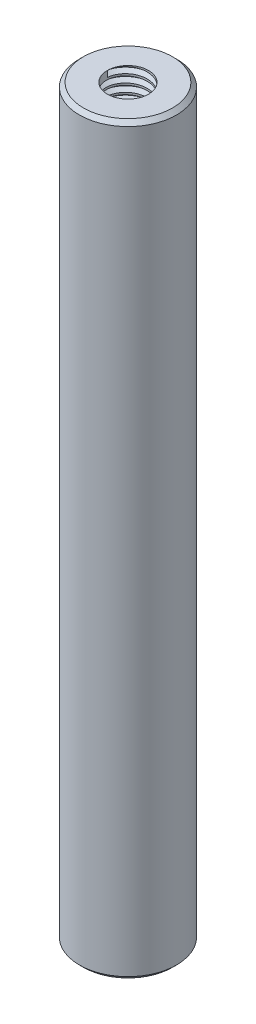
from build123d import *
from build123d.topology import SkipClean

# Parameters (mm, degrees)
CROQUIS2_R              = 4.7625
SALIENTE_EXTRUIR1_DEPTH = 36.5125
CHAFL_N1_SIZE           = 0.396875
TAP_START               = 36.5125
CROQUIS3_R              = 2.0193
TAP_HOLE_1_DEPTH        = 19.05
TAP_START_2             = -17.4625
CROQUIS3_2_R            = 2.0193
TAP_HOLE_2_DEPTH        = 19.05
ROSCA1_PITCH            = 0.79375
ROSCA2_PITCH            = 0.79375


with BuildPart() as part:
    # Croquis2 → Saliente-Extruir1 (new, symmetric)
    with BuildSketch(Plane(origin=(0, 0, 0), x_dir=(1, 0, 0), z_dir=(0, 1, 0))):
        with Locations(Location((0, 0, 0), (0, 0, 270))):
            Circle(CROQUIS2_R)
    extrude(amount=SALIENTE_EXTRUIR1_DEPTH, both=True)

    # Chaflán1
    chafl_n1_edges = [part.edges().sort_by_distance(p)[0] for p in [
        (0, -36.5125, -4.7625),
        (0, 36.5125, -4.7625),
    ]]
    chamfer(chafl_n1_edges, length=CHAFL_N1_SIZE)

    # Croquis3 → Tap Hole 1 (cut)
    with BuildSketch(Plane(origin=(0, 0, 0), x_dir=(1, 0, 0), z_dir=(0, 1, 0)).offset(TAP_START)):
        with Locations(Location((0, 0, 0), (0, 0, 270))):
            Circle(CROQUIS3_R)
    extrude(amount=-TAP_HOLE_1_DEPTH, mode=Mode.SUBTRACT)

    # Croquis3<2> → Tap Hole 2 (cut)
    with BuildSketch(Plane(origin=(0, 0, 0), x_dir=(1, 0, 0), z_dir=(0, 1, 0)).offset(TAP_START_2)):
        with Locations(Location((0, 0, 0), (0, 0, 270))):
            Circle(CROQUIS3_2_R)
    extrude(amount=-TAP_HOLE_2_DEPTH, mode=Mode.SUBTRACT)

    # Rosca1: arcs per turn and ends read off the stored shape
    # Rosca1: the profile of Perfil de rosca1 profile screwed along a right-hand helix through 24 turns, 8 arcs to a turn; built about Z, then put on its axis
    rosca1_z = Axis((0, 0, 0), (0, 0, 1))
    rosca1_corners = [(2.019, 0, -0.000173205), (2.448929788, 0, 0.248046874), (2.448929788, 0, 0.347265624), (2.019, 0, 0.595485703)]
    with BuildLine(mode=Mode.PRIVATE) as rosca1_profile:
        Line(rosca1_corners[0], rosca1_corners[1])
        Line(rosca1_corners[1], rosca1_corners[2])
        Line(rosca1_corners[2], rosca1_corners[3])
        Line(rosca1_corners[3], rosca1_corners[0])
    rosca1_cap = Face(rosca1_profile.wire())
    rosca1_turn_angles = [0, 22.5, 45, 67.5, 90, 112.5, 135, 157.5, 180, 202.5, 225, 247.5, 270, 292.5, 315, 337.5, 360]
    rosca1_turn_weights = [1, 0.9238795325112867, 1, 0.9238795325112867, 1, 0.9238795325112867, 1, 0.9238795325112867, 1, 0.9238795325112867, 1, 0.9238795325112867, 1, 0.9238795325112867, 1, 0.9238795325112867, 1]
    rosca1_turn_rails = [Edge.make_bspline([Vector(p[0], p[1], 0).rotate(rosca1_z, rosca1_turn_angles[k]) / rosca1_turn_weights[k] + Vector(0, 0, p[2] + ROSCA1_PITCH * rosca1_turn_angles[k] / 360) for k in range(17)], [0, 0, 0, 1, 1, 2, 2, 3, 3, 4, 4, 5, 5, 6, 6, 7, 7, 8, 8, 8], 2, rosca1_turn_weights) for p in rosca1_corners]
    rosca1_turn_sides = [Face.make_surface_from_curves(rosca1_turn_rails[p[0]], rosca1_turn_rails[p[1]]) for p in [(0, 1), (1, 2), (2, 3), (3, 0)]]
    rosca1 = Plane(origin=(0, -36.5125, 0), x_dir=(1, 0, 0), z_dir=(0, 1, 0)) * Solid(Shell([*[p.moved(Location((0, 0, ROSCA1_PITCH * i))) for i in range(24) for p in rosca1_turn_sides], rosca1_cap, rosca1_cap.rotate(rosca1_z, 8640).moved(Location((0, 0, ROSCA1_PITCH * 8640 / 360)))]))
    add(rosca1, mode=Mode.SUBTRACT)

    # Rosca2: arcs per turn and ends read off the stored shape
    # Rosca2: the profile of Perfil de rosca2 profile screwed along a right-hand helix through 24 turns, 8 arcs to a turn; built about Z, then put on its axis
    with SkipClean():  # the faces are left unmerged after this step: merging them gives an invalid solid
        rosca2_z = Axis((0, 0, 0), (0, 0, 1))
        rosca2_corners = [(2.019, 0, -0.000173205), (2.448929788, 0, 0.248046874), (2.448929788, 0, 0.347265624), (2.019, 0, 0.595485703)]
        with BuildLine(mode=Mode.PRIVATE) as rosca2_profile:
            Line(rosca2_corners[0], rosca2_corners[1])
            Line(rosca2_corners[1], rosca2_corners[2])
            Line(rosca2_corners[2], rosca2_corners[3])
            Line(rosca2_corners[3], rosca2_corners[0])
        rosca2_cap = Face(rosca2_profile.wire())
        rosca2_turn_angles = [0, 22.5, 45, 67.5, 90, 112.5, 135, 157.5, 180, 202.5, 225, 247.5, 270, 292.5, 315, 337.5, 360]
        rosca2_turn_weights = [1, 0.9238795325112867, 1, 0.9238795325112867, 1, 0.9238795325112867, 1, 0.9238795325112867, 1, 0.9238795325112867, 1, 0.9238795325112867, 1, 0.9238795325112867, 1, 0.9238795325112867, 1]
        rosca2_turn_rails = [Edge.make_bspline([Vector(p[0], p[1], 0).rotate(rosca2_z, rosca2_turn_angles[k]) / rosca2_turn_weights[k] + Vector(0, 0, p[2] + ROSCA2_PITCH * rosca2_turn_angles[k] / 360) for k in range(17)], [0, 0, 0, 1, 1, 2, 2, 3, 3, 4, 4, 5, 5, 6, 6, 7, 7, 8, 8, 8], 2, rosca2_turn_weights) for p in rosca2_corners]
        rosca2_turn_sides = [Face.make_surface_from_curves(rosca2_turn_rails[p[0]], rosca2_turn_rails[p[1]]) for p in [(0, 1), (1, 2), (2, 3), (3, 0)]]
        rosca2 = Plane(origin=(0, 36.5125, 0), x_dir=(-1, 0, 0), z_dir=(0, -1, 0)) * Solid(Shell([*[p.moved(Location((0, 0, ROSCA2_PITCH * i))) for i in range(24) for p in rosca2_turn_sides], rosca2_cap, rosca2_cap.rotate(rosca2_z, 8640).moved(Location((0, 0, ROSCA2_PITCH * 8640 / 360)))]))
        add(rosca2, mode=Mode.SUBTRACT)


solid = part.part
